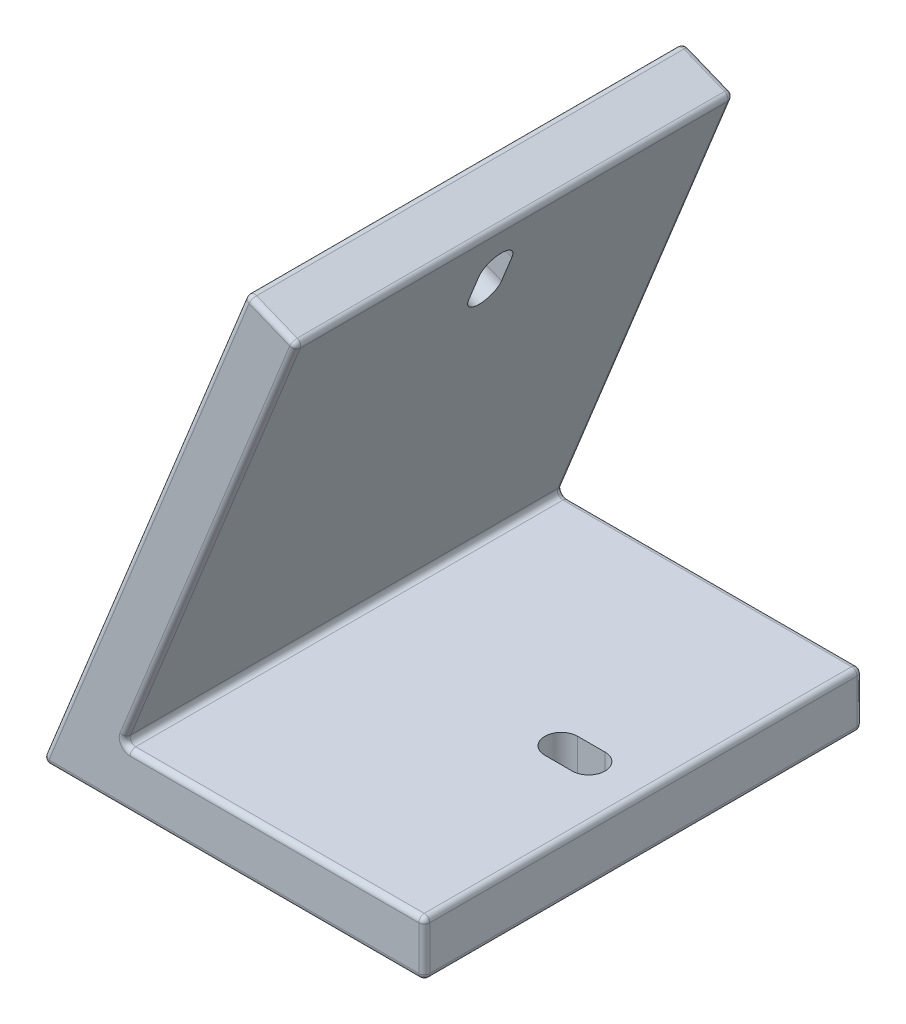
from build123d import *

# Parameters (mm, degrees)
BOSS_EXTRUDE1_DEPTH = 40
CUT_EXTRUDE1_DEPTH  = 116.509009573
CUT_EXTRUDE2_DEPTH  = 121.802731657
FILLET1_R           = 1


with BuildPart() as part:
    # Sketch1 → Boss-Extrude1 (new, symmetric)
    with BuildSketch(Plane.XY):
        Polygon((0, 0), (37.460659342, 92.718385457), (46.732497887, 88.972319523), (14.825609685, 10), (70, 10), (70, 0), align=None)
    extrude(amount=BOSS_EXTRUDE1_DEPTH, both=True)

    # Sketch2 → Cut-Extrude1 (cut, through all)
    with BuildSketch(Plane(origin=(0, 10, 0), x_dir=(1, 0, 0), z_dir=(0, 1, 0))):
        with BuildLine():
            Line((60, -3), (55, -3))
            ThreePointArc((55, -3), (52, 0), (55, 3))
            Line((55, 3), (60, 3))
            ThreePointArc((60, 3), (63, 0), (60, -3))
        make_face()
    extrude(amount=-CUT_EXTRUDE1_DEPTH, mode=Mode.SUBTRACT)

    # Sketch3 → Cut-Extrude2 (cut, through all)
    with BuildSketch(Plane(origin=(9.271838546, -3.746065934, 0), x_dir=(0, 0, -1), z_dir=(0.9271838545667856, -0.3746065934159163, 0))):
        with BuildLine():
            Line((3, 90), (3, 85))
            ThreePointArc((3, 85), (0, 82), (-3, 85))
            Line((-3, 85), (-3, 90))
            ThreePointArc((-3, 90), (0, 93), (3, 90))
        make_face()
    extrude(amount=-CUT_EXTRUDE2_DEPTH, mode=Mode.SUBTRACT)

    # Fillet1
    fillet1_edges = [part.edges().sort_by_distance(p)[0] for p in [
        (70, 0, 0),
        (70, 10, 0),
        (46.732497887, 88.972319523, 0),
        (37.460659342, 92.718385457, 0),
        (18.730329671, 46.359192728, 40),
        (42.096578614, 90.84535249, 40),
        (30.779053786, 49.486159761, 40),
        (42.412804843, 10, 40),
        (70, 5, 40),
        (35, 0, 40),
        (70, 5, -40),
        (42.412804843, 10, -40),
        (30.779053786, 49.486159761, -40),
        (42.096578614, 90.84535249, -40),
        (18.730329671, 46.359192728, -40),
        (35, 0, -40),
        (14.825609685, 10, 0),
        (0, 0, 0),
    ]]
    fillet(fillet1_edges, radius=FILLET1_R)


solid = part.part
